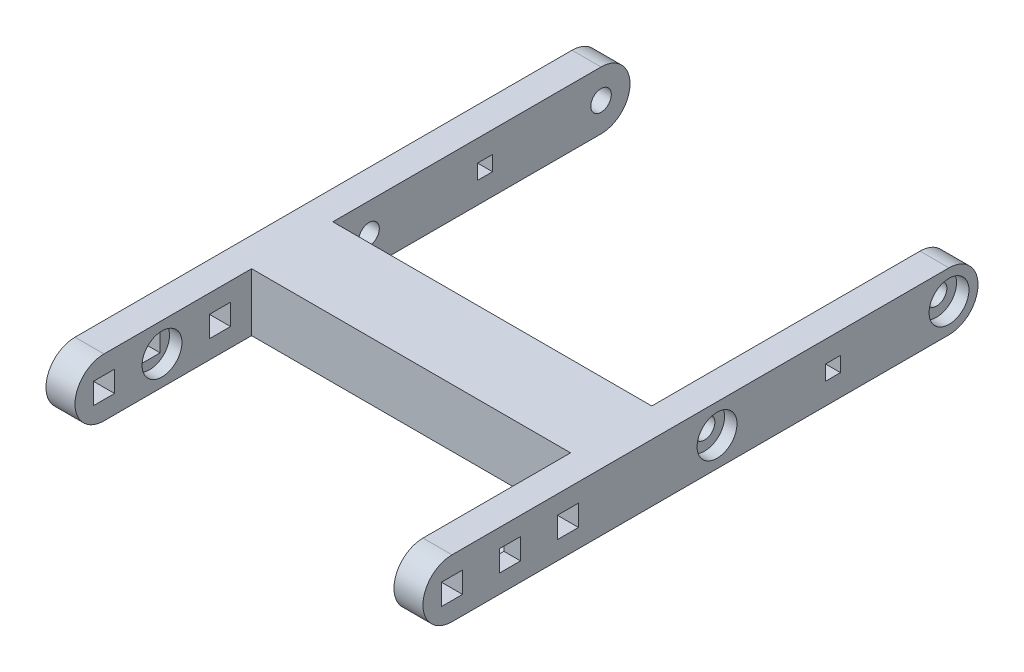
from build123d import *

# Parameters (mm, degrees)
SKETCH1_W                                      = 3.275
SKETCH1_H                                      = 3.275
SKETCH1_W_2                                    = 4.6228
SKETCH1_H_2                                    = 4.6228
BOSS_EXTRUDE1_DEPTH                            = 6.35
CBORE_FOR_8_BUTTON_HEAD_CAP_SCREW1_D           = 4.4958
CBORE_FOR_8_BUTTON_HEAD_CAP_SCREW1_CBORE_D     = 8.73252
CBORE_FOR_8_BUTTON_HEAD_CAP_SCREW1_CBORE_DEPTH = 2.7178
CBORE_FOR_8_BUTTON_HEAD_CAP_SCREW2_D           = 4.4958
CBORE_FOR_8_BUTTON_HEAD_CAP_SCREW2_CBORE_D     = 8.73252
CBORE_FOR_8_BUTTON_HEAD_CAP_SCREW2_CBORE_DEPTH = 2.7178
SKETCH10_W                                     = 17.78
SKETCH10_H                                     = 12.7
BOSS_EXTRUDE2_DEPTH                            = 38.1
MIRROR5_START                                  = -76.2
MIRROR5_OUTLINE_R                              = 4.36626
MIRROR5_OUTLINE_W                              = 3.275
MIRROR5_OUTLINE_H                              = 3.275
MIRROR5_OUTLINE_W_2                            = 4.6228
MIRROR5_OUTLINE_H_2                            = 4.6228
MIRROR5_DEPTH                                  = 6.35
MIRROR5_START_2                                = -73.4822
MIRROR5_2_OUTLINE_R                            = 4.36626
MIRROR5_2_OUTLINE_R_2                          = 2.2479
MIRROR5_2_DEPTH                                = 3.6322
MIRROR5_3_OUTLINE_R                            = 4.36626
MIRROR5_3_OUTLINE_W                            = 4.6228
MIRROR5_3_OUTLINE_H                            = 4.6228
MIRROR5_3_DEPTH                                = 3.6322


# Read off the part's stored shape, not the designer's step: Mirror5
with BuildPart() as part:
    # Sketch1 → Boss-Extrude1 (new body)
    with BuildSketch(Plane(origin=(0, 0, 0), x_dir=(0, 0, -1), z_dir=(1, 0, 0))):
        with BuildLine():
            Line((-83.439, -6.35), (25.4, -6.35))
            ThreePointArc((25.4, -6.35), (31.75, 0), (25.4, 6.35))
            Line((25.4, 6.35), (-83.439, 6.35))
            ThreePointArc((-83.439, 6.35), (-89.789, 0), (-83.439, -6.35))
        make_face()
        Rectangle(SKETCH1_W, SKETCH1_H, mode=Mode.SUBTRACT)
        with Locations((-83.439, 0)):
            Rectangle(SKETCH1_W_2, SKETCH1_H_2, mode=Mode.SUBTRACT)
        with Locations((-58.039, 0)):
            Rectangle(SKETCH1_W_2, SKETCH1_H_2, mode=Mode.SUBTRACT)
        with Locations((-70.739, 0)):
            Rectangle(SKETCH1_W_2, SKETCH1_H_2, mode=Mode.SUBTRACT)
    extrude(amount=BOSS_EXTRUDE1_DEPTH)

    # CBORE for #8 Button Head Cap Screw1 (through all)
    with Locations(Plane(origin=(6.35, 0, 25.4), x_dir=(0, 0, 1), z_dir=(1, 0, 0))):
        with Locations((0, 0), (-50.8, 0)):
            CounterBoreHole(CBORE_FOR_8_BUTTON_HEAD_CAP_SCREW1_D / 2, CBORE_FOR_8_BUTTON_HEAD_CAP_SCREW1_CBORE_D / 2, CBORE_FOR_8_BUTTON_HEAD_CAP_SCREW1_CBORE_DEPTH)

    # CBORE for #8 Button Head Cap Screw2 (through all)
    with Locations(Plane(origin=(0, 0, 70.739), x_dir=(0, 0, -1), z_dir=(-1, 0, 0))):
        with Locations((0, 0)):
            CounterBoreHole(CBORE_FOR_8_BUTTON_HEAD_CAP_SCREW2_D / 2, CBORE_FOR_8_BUTTON_HEAD_CAP_SCREW2_CBORE_D / 2, CBORE_FOR_8_BUTTON_HEAD_CAP_SCREW2_CBORE_DEPTH)

    # Sketch10 → Boss-Extrude2 (add)
    with BuildSketch(Plane.ZY):
        with Locations((42.2275, 0)):
            Rectangle(SKETCH10_W, SKETCH10_H)
    boss_extrude2 = extrude(amount=BOSS_EXTRUDE2_DEPTH)

    # Mirror4: Boss-Extrude2 across plane
    add(boss_extrude2.mirror(Plane.ZY.offset(34.925)))

    # Mirror5 outline → Mirror5 (add)
    with BuildSketch(Plane.YZ.offset(MIRROR5_START)):
        with BuildLine():
            Line((6.35, -25.4), (6.35, 83.439))
            ThreePointArc((6.35, 83.439), (0, 89.789), (-6.35, 83.439))
            Line((-6.35, 83.439), (-6.35, -25.4))
            ThreePointArc((-6.35, -25.4), (0, -31.75), (6.35, -25.4))
        make_face()
        with Locations((0, -25.4)):
            Circle(MIRROR5_OUTLINE_R, mode=Mode.SUBTRACT)
        Rectangle(MIRROR5_OUTLINE_W, MIRROR5_OUTLINE_H, mode=Mode.SUBTRACT)
        with Locations((0, 25.4)):
            Circle(MIRROR5_OUTLINE_R, mode=Mode.SUBTRACT)
        with Locations((0, 58.039)):
            Rectangle(MIRROR5_OUTLINE_W_2, MIRROR5_OUTLINE_H_2, mode=Mode.SUBTRACT)
        with Locations((0, 70.739)):
            Circle(MIRROR5_OUTLINE_R, mode=Mode.SUBTRACT)
        with Locations((0, 83.439)):
            Rectangle(MIRROR5_OUTLINE_W_2, MIRROR5_OUTLINE_H_2, mode=Mode.SUBTRACT)
    extrude(amount=MIRROR5_DEPTH)

    # Mirror5 2 outline → Mirror5 2 (add)
    # profile 1 of 2: a face of its own
    with BuildSketch(Plane.YZ.offset(MIRROR5_START_2)):
        with Locations((0, -25.4)):
            Circle(MIRROR5_2_OUTLINE_R)
        with Locations((0, -25.4)):
            Circle(MIRROR5_2_OUTLINE_R_2, mode=Mode.SUBTRACT)
    # profile 2 of 2: a face of its own
    with BuildSketch(Plane.YZ.offset(MIRROR5_START_2)):
        with Locations((0, 25.4)):
            Circle(MIRROR5_2_OUTLINE_R)
        with Locations((0, 25.4)):
            Circle(MIRROR5_2_OUTLINE_R_2, mode=Mode.SUBTRACT)
    extrude(amount=MIRROR5_2_DEPTH)

    # Mirror5 3 outline → Mirror5 3 (add)
    with BuildSketch(Plane.YZ.offset(MIRROR5_START)):
        with Locations((0, 70.739)):
            Circle(MIRROR5_3_OUTLINE_R)
        with Locations((0, 70.739)):
            Rectangle(MIRROR5_3_OUTLINE_W, MIRROR5_3_OUTLINE_H, mode=Mode.SUBTRACT)
    extrude(amount=MIRROR5_3_DEPTH)


solid = part.part
